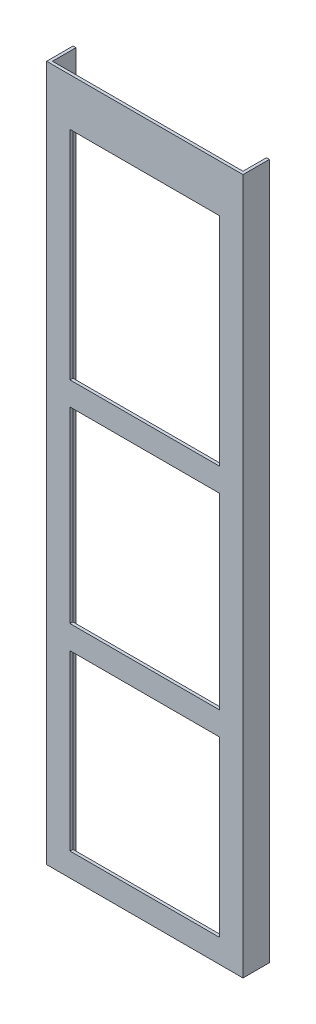
from build123d import *

# Parameters (mm, degrees)
SKETCH1_W              = 103.175
SKETCH1_H              = 103.175
SKETCH1_W_2            = 100
SKETCH1_H_2            = 100
BULKSHELLEXTRUDE_DEPTH = 376.8
SKETCH14_W             = 77.775
SKETCH14_H             = 351.4
SIDEWALLCUT_DEPTH      = 103.1875
SKETCH22_W             = 100
SKETCH22_H             = 376.8
CUT_EXTRUDE4_DEPTH     = 103.1875
SKETCH23_W             = 1.5875
SKETCH23_H             = 376.8
BOSS_EXTRUDE1_DEPTH    = 1.5875
SKETCH24_W             = 1.5875
SKETCH24_H             = 376.8
BOSS_EXTRUDE2_DEPTH    = 12.7
SKETCH25_W             = 80.95
SKETCH25_H             = 351.4
CUT_EXTRUDE5_DEPTH     = 2.54
SKETCH26_W             = 80.95
SKETCH26_H             = 12.7
SKETCH26_H_2           = 12.945
BOSS_EXTRUDE3_DEPTH    = 1.5875


with BuildPart() as part:
    # Sketch1 → BulkShellExtrude (new body)
    with BuildSketch(Plane(origin=(0, 0, 0), x_dir=(1, 0, 0), z_dir=(0, 1, 0))):
        Rectangle(SKETCH1_W, SKETCH1_H)
        Rectangle(SKETCH1_W_2, SKETCH1_H_2, mode=Mode.SUBTRACT)
    extrude(amount=BULKSHELLEXTRUDE_DEPTH)

    # Sketch14 → SideWallCut (cut)
    with BuildSketch(Plane(origin=(51.5875, 0, 0), x_dir=(0, 0, -1), z_dir=(1, 0, 0))):
        with Locations((0, 188.4)):
            Rectangle(SKETCH14_W, SKETCH14_H)
    extrude(amount=-SIDEWALLCUT_DEPTH, mode=Mode.SUBTRACT)

    # Sketch22 → Cut-Extrude4 (cut)
    with BuildSketch(Plane(origin=(51.5875, 0, 0), x_dir=(0, 0, -1), z_dir=(1, 0, 0))):
        with Locations((0, 188.4)):
            Rectangle(SKETCH22_W, SKETCH22_H)
    extrude(amount=-CUT_EXTRUDE4_DEPTH, mode=Mode.SUBTRACT)


with BuildPart() as body_2:
    # of the pieces the cut leaves, the one that is kept (cut_extrude4_keep)
    add(part.part.solids().sort_by_distance((51.5875, 0, 51.5875))[0])

    # Sketch23 → Boss-Extrude1 (add)
    with BuildSketch(Plane(origin=(51.5875, 0, 0), x_dir=(0, 0, -1), z_dir=(1, 0, 0))):
        with Locations((-50.79375, 188.4)):
            Rectangle(SKETCH23_W, SKETCH23_H)
    boss_extrude1 = extrude(amount=BOSS_EXTRUDE1_DEPTH)

    # Mirror1: Boss-Extrude1 across plane
    add(boss_extrude1.mirror(Plane(origin=(0, 0, 0), x_dir=(0, 0, 1), z_dir=(1, 0, 0))))

    # Sketch24 → Boss-Extrude2 (add)
    with BuildSketch(Plane(origin=(0, 0, 50), x_dir=(-1, 0, 0), z_dir=(0, 0, -1))):
        with Locations((-52.38125, 188.4)):
            Rectangle(SKETCH24_W, SKETCH24_H)
        with Locations((52.38125, 188.4)):
            Rectangle(SKETCH24_W, SKETCH24_H)
    extrude(amount=BOSS_EXTRUDE2_DEPTH)

    # Sketch25 → Cut-Extrude5 (cut)
    with BuildSketch(Plane.XY.offset(51.5875)):
        with Locations((0, 188.4)):
            Rectangle(SKETCH25_W, SKETCH25_H)
    extrude(amount=-CUT_EXTRUDE5_DEPTH, mode=Mode.SUBTRACT)

    # Sketch26 → Boss-Extrude3 (add)
    with BuildSketch(Plane.XY.offset(51.5875)):
        with Locations((0, 227.33)):
            Rectangle(SKETCH26_W, SKETCH26_H)
        with Locations((0, 113.03)):
            Rectangle(SKETCH26_W, SKETCH26_H)
        with Locations((0, 357.6275)):
            Rectangle(SKETCH26_W, SKETCH26_H_2)
    extrude(amount=-BOSS_EXTRUDE3_DEPTH)


solid = body_2.part
